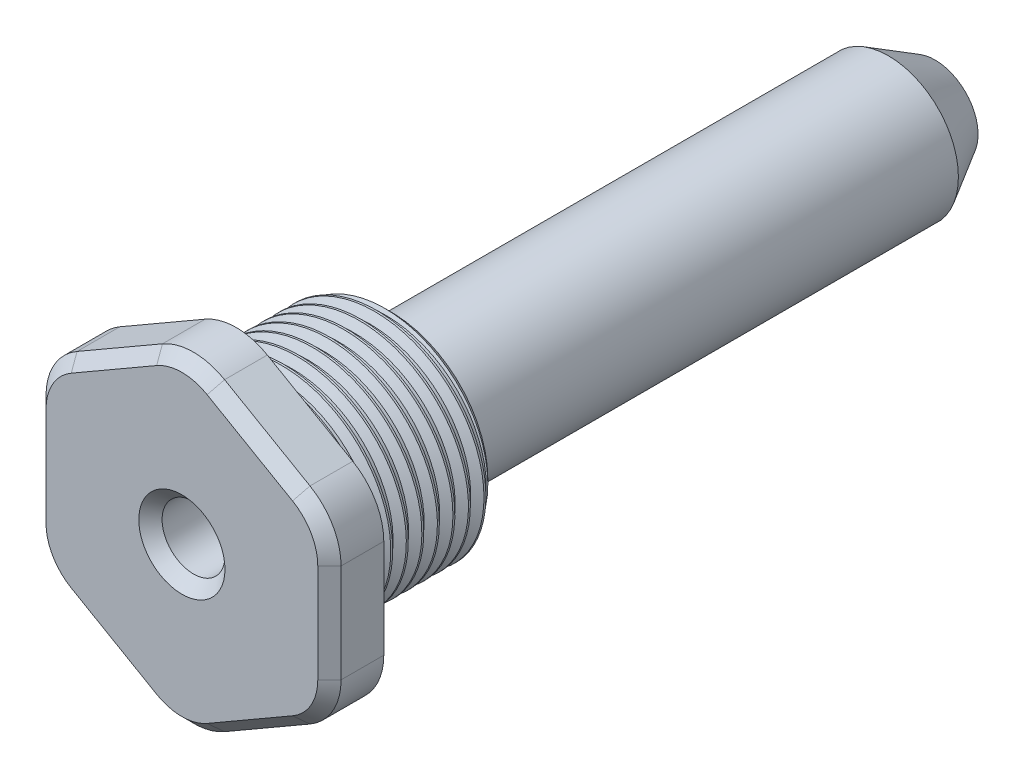
from build123d import *

# Parameters (mm, degrees)
SKETCH1_R           = 6.95
BOSS_EXTRUDE1_DEPTH = 10
CHAMFER1_SIZE       = 0.75
CUT_SWEEP1_PITCH    = 1
BOSS_EXTRUDE2_DEPTH = 3.5
FILLET1_R           = 4
CHAMFER3_SIZE       = 0.75
SKETCH5_R           = 4.5
BOSS_EXTRUDE3_DEPTH = 35
FILLET2_R           = 0.5
SKETCH6_R           = 2.025
CUT_EXTRUDE1_DEPTH  = 30
CHAMFER4_SIZE       = 3.4
CHAMFER4_SIZE2      = 1.962990915
CHAMFER5_SIZE       = 3
CHAMFER5_SIZE2      = 1.732050808
CHAMFER6_SIZE       = 0.75


with BuildPart() as part:
    # Sketch1 → Boss-Extrude1 (new body)
    with BuildSketch(Plane.XY):
        Circle(SKETCH1_R)
    extrude(amount=BOSS_EXTRUDE1_DEPTH)

    # Chamfer1
    chamfer1_edges = [part.edges().sort_by_distance(p)[0] for p in [
        (-6.95, 0, 0),
    ]]
    chamfer(chamfer1_edges, length=CHAMFER1_SIZE)

    # Cut-Sweep1: the profile of Sketch3 profile screwed along a right-hand helix of 11 turns, 8 arcs to a turn; built about Z, then put on its axis
    cut_sweep1_z = Axis((0, 0, 0), (0, 0, 1))
    cut_sweep1_corners = [(6.408734123, 0, -0.3125), (6.408734123, 0, -0.5625), (6.9503, 0, -0.875173205), (6.9503, 0, 0.000173205)]
    with BuildLine(mode=Mode.PRIVATE) as cut_sweep1_profile:
        Line(cut_sweep1_corners[0], cut_sweep1_corners[1])
        Line(cut_sweep1_corners[1], cut_sweep1_corners[2])
        Line(cut_sweep1_corners[2], cut_sweep1_corners[3])
        Line(cut_sweep1_corners[3], cut_sweep1_corners[0])
    cut_sweep1_cap = Face(cut_sweep1_profile.wire())
    cut_sweep1_turn_angles = [0, 22.5, 45, 67.5, 90, 112.5, 135, 157.5, 180, 202.5, 225, 247.5, 270, 292.5, 315, 337.5, 360]
    cut_sweep1_turn_weights = [1, 0.9238795325112867, 1, 0.9238795325112867, 1, 0.9238795325112867, 1, 0.9238795325112867, 1, 0.9238795325112867, 1, 0.9238795325112867, 1, 0.9238795325112867, 1, 0.9238795325112867, 1]
    cut_sweep1_turn_rails = [Edge.make_bspline([Vector(p[0], p[1], 0).rotate(cut_sweep1_z, cut_sweep1_turn_angles[k]) / cut_sweep1_turn_weights[k] + Vector(0, 0, p[2] + CUT_SWEEP1_PITCH * cut_sweep1_turn_angles[k] / 360) for k in range(17)], [0, 0, 0, 1, 1, 2, 2, 3, 3, 4, 4, 5, 5, 6, 6, 7, 7, 8, 8, 8], 2, cut_sweep1_turn_weights) for p in cut_sweep1_corners]
    cut_sweep1_turn_sides = [Face.make_surface_from_curves(cut_sweep1_turn_rails[p[0]], cut_sweep1_turn_rails[p[1]]) for p in [(0, 1), (1, 2), (2, 3), (3, 0)]]
    cut_sweep1 = Plane(origin=(0, 0, 10), x_dir=(1, 0, 0), z_dir=(0, 0, -1)) * Solid(Shell([*[p.moved(Location((0, 0, CUT_SWEEP1_PITCH * i))) for i in range(11) for p in cut_sweep1_turn_sides], cut_sweep1_cap, cut_sweep1_cap.rotate(cut_sweep1_z, 3960).moved(Location((0, 0, CUT_SWEEP1_PITCH * 3960 / 360)))]))
    add(cut_sweep1, mode=Mode.SUBTRACT)

    # Sketch4 → Boss-Extrude2 (add)
    with BuildSketch(Plane.XY.offset(10)):
        Polygon((0, 10.969655115), (-9.5, 5.484827557), (-9.5, -5.484827557), (0, -10.969655115), (9.5, -5.484827557), (9.5, 5.484827557), align=None)
    extrude(amount=BOSS_EXTRUDE2_DEPTH)

    # Fillet1
    fillet1_edges = [part.edges().sort_by_distance(p)[0] for p in [
        (9.5, 5.484827557, 11.75),
        (0, 10.969655115, 11.75),
        (-9.5, 5.484827557, 11.75),
        (-9.5, -5.484827557, 11.75),
        (0, -10.969655115, 11.75),
        (9.5, -5.484827557, 11.75),
    ]]
    fillet(fillet1_edges, radius=FILLET1_R)

    # Chamfer3
    chamfer3_edges = [part.edges().sort_by_distance(p)[0] for p in [
        (9.5, 0, 13.5),
        (4.75, -8.227241336, 13.5),
        (4.75, 8.227241336, 13.5),
        (-4.75, 8.227241336, 13.5),
        (-9.5, 0, 13.5),
        (-4.75, -8.227241336, 13.5),
        (8.964101615, 5.175426481, 13.5),
        (0, 10.350852961, 13.5),
        (-8.964101615, 5.175426481, 13.5),
        (-8.964101615, -5.175426481, 13.5),
        (0, -10.350852961, 13.5),
        (8.964101615, -5.175426481, 13.5),
    ]]
    chamfer(chamfer3_edges, length=CHAMFER3_SIZE)

    # Sketch5 → Boss-Extrude3 (add)
    with BuildSketch(Plane(origin=(0, 0, 0), x_dir=(-1, 0, 0), z_dir=(0, 0, -1))):
        with Locations(Location((0, 0, 0), (0, 0, 180))):
            Circle(SKETCH5_R)
    extrude(amount=BOSS_EXTRUDE3_DEPTH)

    # Fillet2
    fillet2_edges = [part.edges().sort_by_distance(p)[0] for p in [
        (-4.5, 0, 0),
    ]]
    fillet(fillet2_edges, radius=FILLET2_R)

    # Sketch6 → Cut-Extrude1 (cut)
    with BuildSketch(Plane.XY.offset(13.5)):
        Circle(SKETCH6_R)
    extrude(amount=-CUT_EXTRUDE1_DEPTH, mode=Mode.SUBTRACT)

    # Chamfer4
    chamfer4_edges = [part.edges().sort_by_distance(p)[0] for p in [
        (-2.025, 0, -16.5),
    ]]
    chamfer4_side = [part.faces().sort_by_distance(p)[0] for p in [
        (-2.025, 0, -1.5),
    ]]
    chamfer(chamfer4_edges, length=CHAMFER4_SIZE, length2=CHAMFER4_SIZE2, reference=chamfer4_side[0])

    # Chamfer5
    chamfer5_edges = [part.edges().sort_by_distance(p)[0] for p in [
        (-4.5, 0, -35),
    ]]
    chamfer5_side = [part.faces().sort_by_distance(p)[0] for p in [
        (-4.5, 0, -17.75),
    ]]
    chamfer(chamfer5_edges, length=CHAMFER5_SIZE, length2=CHAMFER5_SIZE2, reference=chamfer5_side[0])

    # Chamfer6
    chamfer6_edges = [part.edges().sort_by_distance(p)[0] for p in [
        (-2.025, 0, 13.5),
    ]]
    chamfer(chamfer6_edges, length=CHAMFER6_SIZE)


solid = part.part
